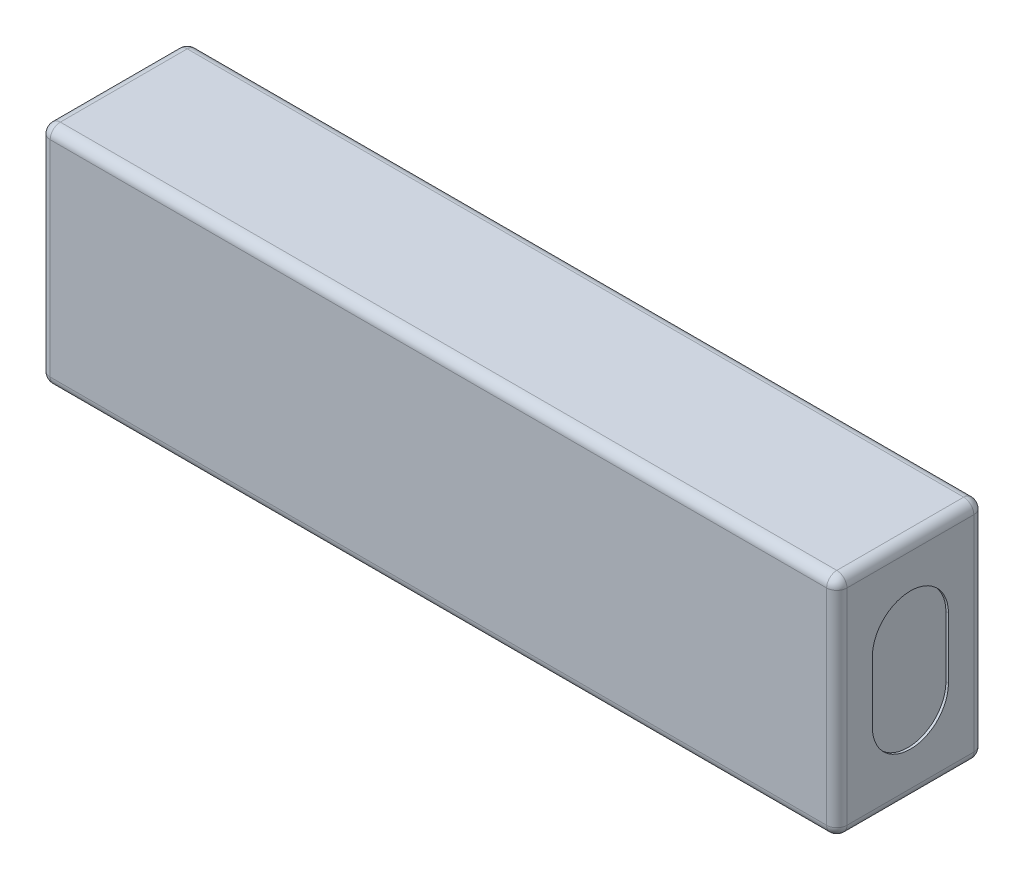
from build123d import *

# Parameters (mm, degrees)
ESBO_O1_W                = 157
ESBO_O1_H                = 44.5
RESSALTO_EXTRUS_O1_DEPTH = 14.5
CORTE_EXTRUS_O1_DEPTH    = 0.5
FILETE1_R                = 2


with BuildPart() as part:
    # Esboço1 → Ressalto-extrusão1 (new, symmetric)
    with BuildSketch(Plane.XY):
        Rectangle(ESBO_O1_W, ESBO_O1_H)
    extrude(amount=RESSALTO_EXTRUS_O1_DEPTH, both=True)

    # Esboço2 → Corte-extrusão1 (cut)
    with BuildSketch(Plane(origin=(78.5, 0, 0), x_dir=(0, 0, -1), z_dir=(1, 0, 0))):
        with BuildLine():
            Line((7.5, 6), (7.5, -6))
            ThreePointArc((7.5, -6), (0, -13.5), (-7.5, -6))
            Line((-7.5, -6), (-7.5, 6))
            ThreePointArc((-7.5, 6), (0, 13.5), (7.5, 6))
        make_face()
    corte_extrus_o1 = extrude(amount=-CORTE_EXTRUS_O1_DEPTH, mode=Mode.SUBTRACT)

    # Espelhar1: Corte-extrusão1 across plane
    add(corte_extrus_o1.mirror(Plane(origin=(0, 0, 0), x_dir=(0, 0, 1), z_dir=(1, 0, 0))), mode=Mode.SUBTRACT)

    # Filete1
    filete1_edges = [part.edges().sort_by_distance(p)[0] for p in [
        (-78.5, -22.25, 0),
        (78.5, -22.25, 0),
        (-78.5, 0, -14.5),
        (0, -22.25, -14.5),
        (78.5, 0, -14.5),
        (78.5, 22.25, 0),
        (-78.5, 22.25, 0),
        (0, 22.25, -14.5),
        (0, -22.25, 14.5),
        (-78.5, 0, 14.5),
        (0, 22.25, 14.5),
        (78.5, 0, 14.5),
    ]]
    fillet(filete1_edges, radius=FILETE1_R)


solid = part.part
